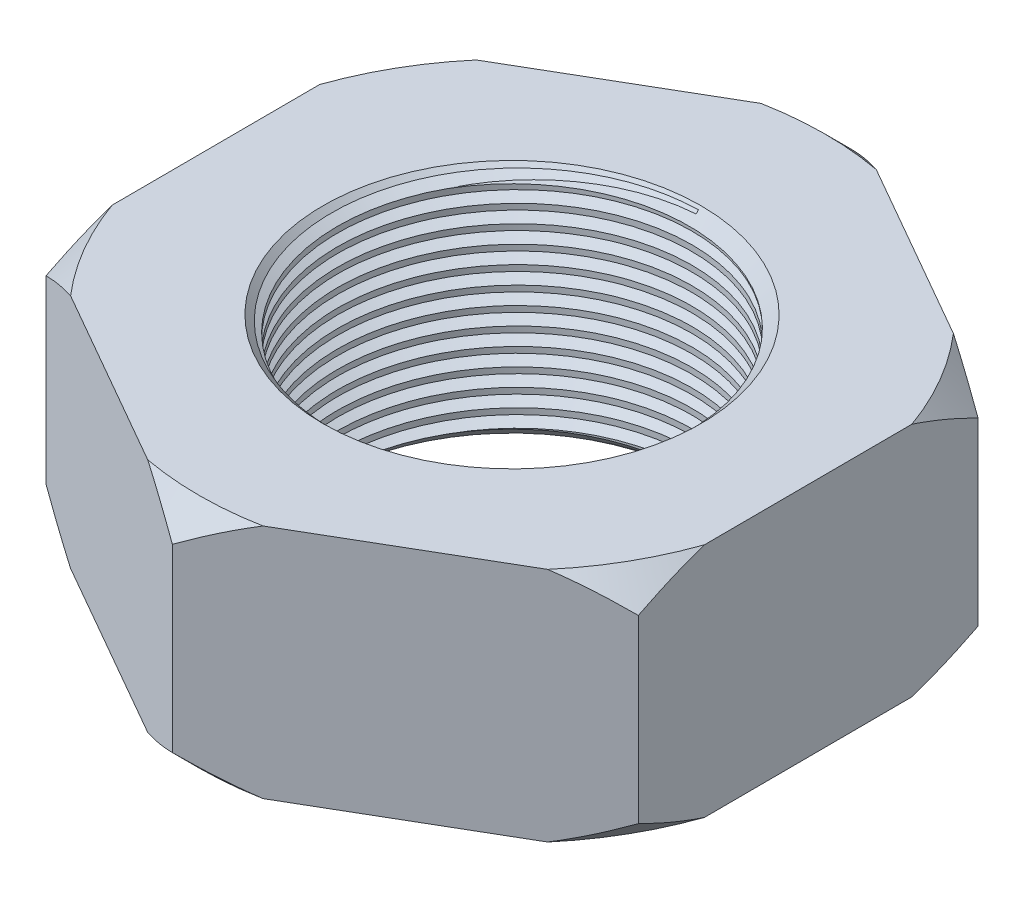
from build123d import *

# Parameters (mm, degrees)
SKETCH1_R           = 15
BOSS_EXTRUDE1_DEPTH = 20
CHAMFER1_SIZE       = 1
CUT_SWEEP1_PITCH    = 1.5


with BuildPart() as part:
    # Sketch1 → Boss-Extrude1 (new body)
    with BuildSketch(Plane(origin=(0, 0, 0), x_dir=(1, 0, 0), z_dir=(0, 1, 0))):
        Polygon((-25.04999461, 14.346815095), (-24.949703641, -14.52052415), (0.100290969, -28.867339244), (25.04999461, -14.346815095), (24.949703641, 14.52052415), (-0.100290969, 28.867339244), align=None)
        with Locations(Location((0, 0, 0), (0, 0, 270))):
            Circle(SKETCH1_R, mode=Mode.SUBTRACT)
    extrude(amount=BOSS_EXTRUDE1_DEPTH)

    # Chamfer1
    chamfer1_edges = [part.edges().sort_by_distance(p)[0] for p in [
        (0, 0, -15),
        (0, 20, -15),
    ]]
    chamfer(chamfer1_edges, length=CHAMFER1_SIZE)

    # Sketch3 → Cut-Revolve1 (revolve, cut)
    with BuildSketch(Plane(origin=(0, 0, 0), x_dir=(0, 0, -1), z_dir=(1, 0, 0))):
        Polygon((-28.867339244, 20), (-28.867339244, 17.641422251), (-26.508761495, 20), align=None)
        Polygon((-26.508761495, 0), (-28.867339244, 0), (-28.867339244, 2.358577749), align=None)
    revolve(axis=Axis((0, -7.154839511, 0), (0, 1, 0)), mode=Mode.SUBTRACT)

    # Cut-Sweep1: arcs per turn and ends read off the stored shape
    # Cut-Sweep1: the profile of Sketch7 profile screwed along a left-hand helix through 13.5 turns, 8 arcs to a turn; built about Z, then put on its axis
    cut_sweep1_z = Axis((0, 0, 0), (0, 0, 1))
    cut_sweep1_corners = [(14.9997, 0, -2.000173205), (14.9997, 0, -0.999826795), (15.866025404, 0, -1.5)]
    with BuildLine(mode=Mode.PRIVATE) as cut_sweep1_profile:
        Line(cut_sweep1_corners[0], cut_sweep1_corners[1])
        Line(cut_sweep1_corners[1], cut_sweep1_corners[2])
        Line(cut_sweep1_corners[2], cut_sweep1_corners[0])
    cut_sweep1_cap = Face(cut_sweep1_profile.wire())
    cut_sweep1_turn_angles = [0, -22.5, -45, -67.5, -90, -112.5, -135, -157.5, -180, -202.5, -225, -247.5, -270, -292.5, -315, -337.5, -360]
    cut_sweep1_turn_weights = [1, 0.9238795325112867, 1, 0.9238795325112867, 1, 0.9238795325112867, 1, 0.9238795325112867, 1, 0.9238795325112867, 1, 0.9238795325112867, 1, 0.9238795325112867, 1, 0.9238795325112867, 1]
    cut_sweep1_turn_rails = [Edge.make_bspline([Vector(p[0], p[1], 0).rotate(cut_sweep1_z, cut_sweep1_turn_angles[k]) / cut_sweep1_turn_weights[k] + Vector(0, 0, p[2] + -CUT_SWEEP1_PITCH * cut_sweep1_turn_angles[k] / 360) for k in range(17)], [0, 0, 0, 1, 1, 2, 2, 3, 3, 4, 4, 5, 5, 6, 6, 7, 7, 8, 8, 8], 2, cut_sweep1_turn_weights) for p in cut_sweep1_corners]
    cut_sweep1_turn_sides = [Face.make_surface_from_curves(cut_sweep1_turn_rails[p[0]], cut_sweep1_turn_rails[p[1]]) for p in [(0, 1), (1, 2), (2, 0)]]
    cut_sweep1_last_angles = [-4680, -4702.5, -4725, -4747.5, -4770, -4792.5, -4815, -4837.5, -4860]
    cut_sweep1_last_weights = [1, 0.9238795325112867, 1, 0.9238795325112867, 1, 0.9238795325112867, 1, 0.9238795325112867, 1]
    cut_sweep1_last_rails = [Edge.make_bspline([Vector(p[0], p[1], 0).rotate(cut_sweep1_z, cut_sweep1_last_angles[k]) / cut_sweep1_last_weights[k] + Vector(0, 0, p[2] + -CUT_SWEEP1_PITCH * cut_sweep1_last_angles[k] / 360) for k in range(9)], [0, 0, 0, 1, 1, 2, 2, 3, 3, 4, 4, 4], 2, cut_sweep1_last_weights) for p in cut_sweep1_corners]
    cut_sweep1_last_sides = [Face.make_surface_from_curves(cut_sweep1_last_rails[p[0]], cut_sweep1_last_rails[p[1]]) for p in [(0, 1), (1, 2), (2, 0)]]
    cut_sweep1 = Plane(origin=(0, 1, 0), x_dir=(0, 0, 1), z_dir=(0, 1, 0)) * Solid(Shell([*[p.moved(Location((0, 0, CUT_SWEEP1_PITCH * i))) for i in range(13) for p in cut_sweep1_turn_sides], *cut_sweep1_last_sides, cut_sweep1_cap, cut_sweep1_cap.rotate(cut_sweep1_z, -4860).moved(Location((0, 0, -CUT_SWEEP1_PITCH * -4860 / 360)))]))
    add(cut_sweep1, mode=Mode.SUBTRACT)


solid = part.part
